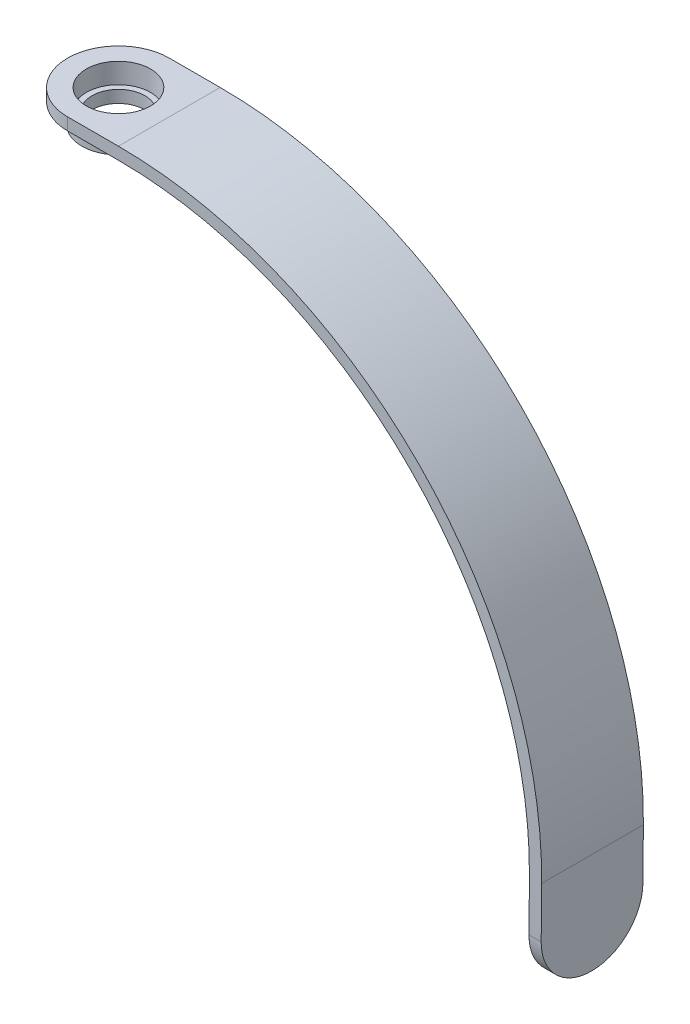
from build123d import *

# Parameters (mm, degrees)
BOSS_EXTRUDE1_DEPTH = 25
FILLET1_R           = 12.5
SKETCH4_R           = 3.225
BOSS_EXTRUDE2_DEPTH = 6
SKETCH6_R           = 9
SKETCH6_R_2         = 6.5
BOSS_EXTRUDE3_DEPTH = 5
SKETCH5_R           = 7.89
CUT_EXTRUDE1_DEPTH  = 5


with BuildPart() as part:
    # Sketch2 → Boss-Extrude1 (new body)
    with BuildSketch(Plane.XY):
        with BuildLine():
            Line((0, 104), (-25, 104))
            Line((-25, 104), (-25, 101))
            Line((-25, 101), (0, 101))
            ThreePointArc((0, 101), (71.728722938, 71.10548717), (100.996154229, -0.881380085))
            Line((100.996154229, -0.881380085), (100.777990842, -25.880428162))
            Line((100.777990842, -25.880428162), (103.777876611, -25.906607768))
            Line((103.777876611, -25.906607768), (103.996039999, -0.907559692))
            ThreePointArc((103.996039999, -0.907559692), (73.859279065, 73.217531343), (0, 104))
        make_face()
    extrude(amount=BOSS_EXTRUDE1_DEPTH)

    # Fillet1
    fillet1_edges = [part.edges().sort_by_distance(p)[0] for p in [
        (102.277933727, -25.893517965, 0),
        (102.277933727, -25.893517965, 25),
        (-25, 102.5, 25),
        (-25, 102.5, 0),
    ]]
    fillet(fillet1_edges, radius=FILLET1_R - 0.0001)  # a hair under: the kernel refuses the full size

    # Sketch4 → Boss-Extrude2 (add)
    with BuildSketch(Plane(origin=(100.996154229, -0.881380085, 0), x_dir=(0, 0, 1), z_dir=(-0.9999619230641714, 0.008726535498377326, 0))):
        with Locations(Location((12.5, -12.5, 0), (0, 0, 90))):
            Circle(SKETCH4_R)
    extrude(amount=BOSS_EXTRUDE2_DEPTH)

    # Sketch6 → Boss-Extrude3 (add)
    with BuildSketch(Plane(origin=(0, 101, 0), x_dir=(1, 0, 0), z_dir=(0, 1, 0))):
        with Locations(Location((-12.5, -12.5, 0), (0, 0, 270))):
            Circle(SKETCH6_R)
        with Locations(Location((-12.5, -12.5, 0), (0, 0, 270))):
            Circle(SKETCH6_R_2, mode=Mode.SUBTRACT)
    extrude(amount=-BOSS_EXTRUDE3_DEPTH)

    # Sketch5 → Cut-Extrude1 (cut)
    with BuildSketch(Plane.XZ.offset(-104)):
        with Locations(Location((-12.5, 12.5, 0), (0, 0, 270))):
            Circle(SKETCH5_R)
    extrude(amount=CUT_EXTRUDE1_DEPTH, mode=Mode.SUBTRACT)


solid = part.part
